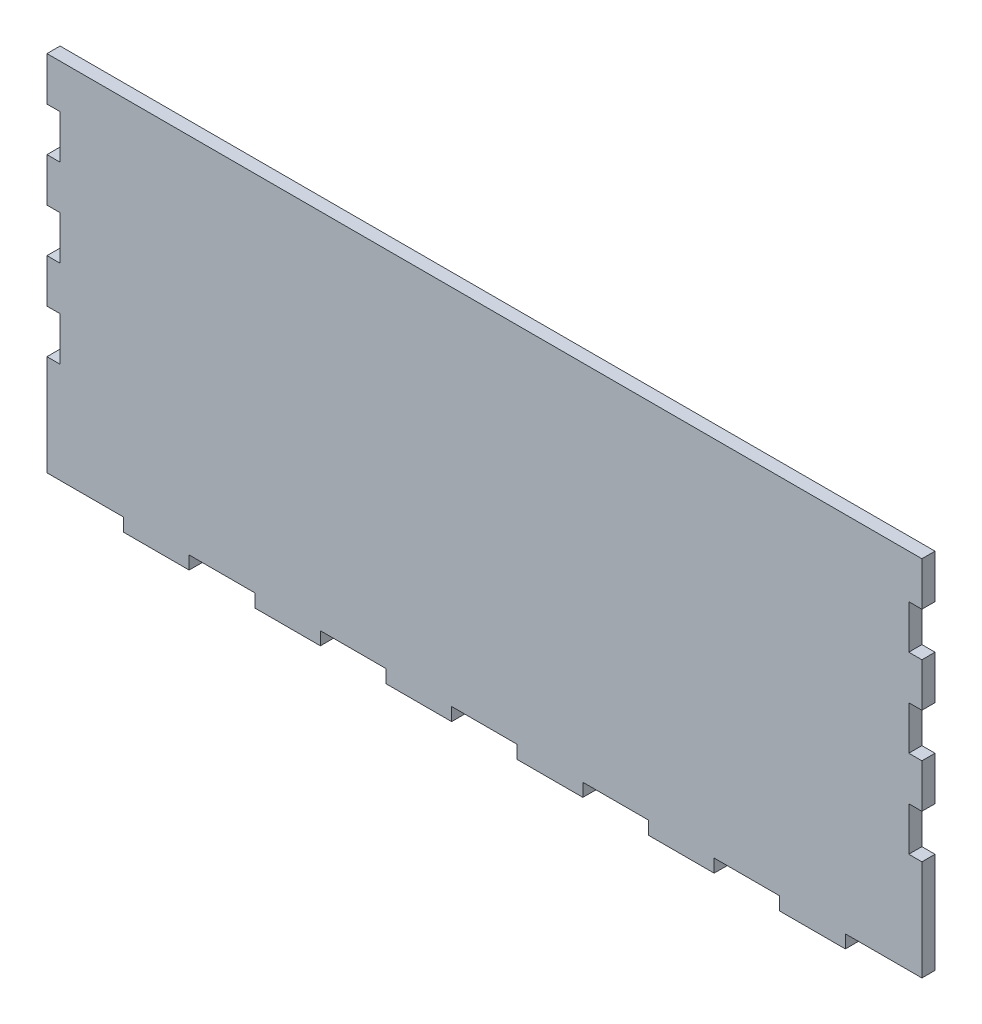
from build123d import *

# Parameters (mm, degrees)
BOSS_EXTRUDE1_DEPTH = 3


with BuildPart() as part:
    # Sketch1 → Boss-Extrude1 (new body)
    with BuildSketch(Plane.XY):
        Polygon((100, -2.5), (97, -2.5), (97, 7.5), (100, 7.5), (100, 17.5), (97, 17.5), (97, 27.5), (100, 27.5), (100, 37.5), (97, 37.5), (97, 47.5), (100, 47.5), (100, 57.5), (97, 57.5), (-97, 57.5), (-100, 57.5), (-100, 47.5), (-97, 47.5), (-97, 37.5), (-100, 37.5), (-100, 27.5), (-97, 27.5), (-97, 17.5), (-100, 17.5), (-100, 7.5), (-97, 7.5), (-97, -2.5), (-100, -2.5), (-100, -25.5), (-97, -25.5), (-82.5, -25.5), (-82.5, -28.5), (-67.5, -28.5), (-67.5, -25.5), (-52.5, -25.5), (-52.5, -28.5), (-37.5, -28.5), (-37.5, -25.5), (-22.5, -25.5), (-22.5, -28.5), (-7.5, -28.5), (-7.5, -25.5), (0, -25.5), (7.5, -25.5), (7.5, -28.5), (22.5, -28.5), (22.5, -25.5), (30, -25.5), (37.5, -25.5), (37.5, -28.5), (52.5, -28.5), (52.5, -25.5), (60, -25.5), (67.5, -25.5), (67.5, -28.5), (82.5, -28.5), (82.5, -25.5), (97, -25.5), (100, -25.5), align=None)
    extrude(amount=BOSS_EXTRUDE1_DEPTH)


solid = part.part
